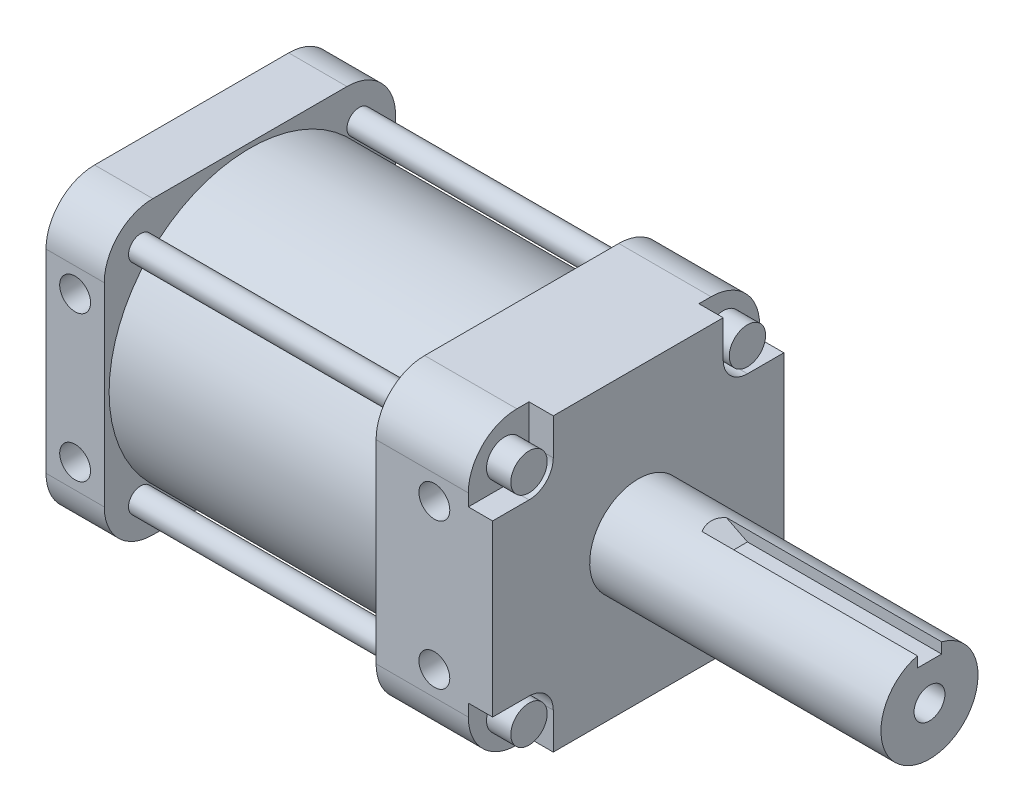
from build123d import *

# Parameters (mm, degrees)
BOSS_EXTRUDE1_DEPTH                  = 7.62
SKETCH2_R                            = 18.415
BOSS_EXTRUDE2_DEPTH                  = 35.56
BOSS_EXTRUDE3_DEPTH                  = 15.24
SKETCH5_R                            = 6.35
BOSS_EXTRUDE4_DEPTH                  = 38.1
F_10_32_TAPPED_HOLE1_D               = 4.0386
F_10_32_TAPPED_HOLE1_DEPTH           = 7.62
F_10_32_TAPPED_HOLE1_TIP             = 1.213317848
F_10_32_TAPPED_HOLE1_ON_FACE_2_D     = 4.0386
F_10_32_TAPPED_HOLE1_ON_FACE_2_DEPTH = 7.62
F_10_32_TAPPED_HOLE1_ON_FACE_2_TIP   = 1.213317848
CUT_EXTRUDE1_START                   = -7.62
SKETCH8_R                            = 17.78
CUT_EXTRUDE1_DEPTH                   = 45.72
CUT_EXTRUDE2_REACH                   = 102.209
SKETCH9_R                            = 6
CUT_EXTRUDE3_DEPTH                   = 1.5875
F_10_32_TAPPED_HOLE2_D               = 4.0386
F_10_32_TAPPED_HOLE2_DEPTH           = 7.62
F_10_32_TAPPED_HOLE2_TIP             = 1.213317848
CUT_EXTRUDE4_DEPTH                   = 3.175
BOSS_EXTRUDE5_REACH                  = 61.758
SKETCH15_R                           = 1.5875
SKETCH16_R                           = 2.38125
BOSS_EXTRUDE6_DEPTH                  = 3.175


with BuildPart() as part:
    # Sketch1 → Boss-Extrude1 (new body)
    with BuildSketch(Plane(origin=(0, 0, 0), x_dir=(0, 0, -1), z_dir=(1, 0, 0))):
        with BuildLine():
            Line((-12.7, 19.05), (12.7, 19.05))
            ThreePointArc((12.7, 19.05), (17.190128061, 17.190128061), (19.05, 12.7))
            Line((19.05, 12.7), (19.05, -12.7))
            ThreePointArc((19.05, -12.7), (17.190128061, -17.190128061), (12.7, -19.05))
            Line((12.7, -19.05), (-12.7, -19.05))
            ThreePointArc((-12.7, -19.05), (-17.190128061, -17.190128061), (-19.05, -12.7))
            Line((-19.05, -12.7), (-19.05, 12.7))
            ThreePointArc((-19.05, 12.7), (-17.190128061, 17.190128061), (-12.7, 19.05))
        make_face()
    extrude(amount=BOSS_EXTRUDE1_DEPTH)

    # Sketch2 → Boss-Extrude2 (add)
    with BuildSketch(Plane(origin=(7.62, 0, 0), x_dir=(0, 0, -1), z_dir=(1, 0, 0))):
        Circle(SKETCH2_R)
    extrude(amount=BOSS_EXTRUDE2_DEPTH)

    # Sketch4 → Boss-Extrude3 (add)
    with BuildSketch(Plane(origin=(43.18, 0, 0), x_dir=(0, 0, -1), z_dir=(1, 0, 0))):
        with BuildLine():
            Line((12.7, 19.05), (-12.7, 19.05))
            ThreePointArc((-12.7, 19.05), (-17.190128061, 17.190128061), (-19.05, 12.7))
            Line((-19.05, 12.7), (-19.05, -12.7))
            ThreePointArc((-19.05, -12.7), (-17.190128061, -17.190128061), (-12.7, -19.05))
            Line((-12.7, -19.05), (12.7, -19.05))
            ThreePointArc((12.7, -19.05), (17.190128061, -17.190128061), (19.05, -12.7))
            Line((19.05, -12.7), (19.05, 12.7))
            ThreePointArc((19.05, 12.7), (17.190128061, 17.190128061), (12.7, 19.05))
        make_face()
    extrude(amount=BOSS_EXTRUDE3_DEPTH)

    # Sketch5 → Boss-Extrude4 (add)
    with BuildSketch(Plane(origin=(58.42, 0, 0), x_dir=(0, 0, -1), z_dir=(1, 0, 0))):
        Circle(SKETCH5_R)
    extrude(amount=BOSS_EXTRUDE4_DEPTH)

    # #10-32 Tapped Hole1
    with Locations(Plane(origin=(50.8, 9.525, -19.05), x_dir=(-1, 0, 0), z_dir=(0, 0, -1))):
        with Locations((0, 0), (0, -19.05), (46.99, 0), (46.99, -19.05)):
            Hole(F_10_32_TAPPED_HOLE1_D / 2, depth=F_10_32_TAPPED_HOLE1_DEPTH)
            with Locations((0, 0, -(F_10_32_TAPPED_HOLE1_DEPTH + F_10_32_TAPPED_HOLE1_TIP / 2))):  # 118° drill point
                Cone(0, F_10_32_TAPPED_HOLE1_D / 2, F_10_32_TAPPED_HOLE1_TIP, mode=Mode.SUBTRACT)

    # #10-32 Tapped Hole1 on face 2
    with Locations(Plane(origin=(50.8, 9.525, 19.05), x_dir=(1, 0, 0), z_dir=(0, 0, 1))):
        with Locations((0, 0), (0, -19.05), (-46.99, 0), (-46.99, -19.05)):
            Hole(F_10_32_TAPPED_HOLE1_ON_FACE_2_D / 2, depth=F_10_32_TAPPED_HOLE1_ON_FACE_2_DEPTH)
            with Locations((0, 0, -(F_10_32_TAPPED_HOLE1_ON_FACE_2_DEPTH + F_10_32_TAPPED_HOLE1_ON_FACE_2_TIP / 2))):  # 118° drill point
                Cone(0, F_10_32_TAPPED_HOLE1_ON_FACE_2_D / 2, F_10_32_TAPPED_HOLE1_ON_FACE_2_TIP, mode=Mode.SUBTRACT)

    # Sketch8 → Cut-Extrude1 (cut)
    with BuildSketch(Plane.ZY.offset(CUT_EXTRUDE1_START)):
        Circle(SKETCH8_R)
    extrude(amount=-CUT_EXTRUDE1_DEPTH, mode=Mode.SUBTRACT)

    # Sketch9 → Cut-Extrude2 (cut, up to next)
    with BuildSketch(Plane.ZY, mode=Mode.PRIVATE) as cut_extrude2_sk1:
        Circle(SKETCH9_R)
    cut_extrude2_tool1 = extrude(cut_extrude2_sk1.sketch, amount=-CUT_EXTRUDE2_REACH, mode=Mode.PRIVATE) & part.part
    add(cut_extrude2_tool1.solids().sort_by_distance((0, 0, 0))[0], mode=Mode.SUBTRACT)

    # Sketch10 → Cut-Extrude3 (cut, symmetric)
    with BuildSketch(Plane.XY):
        Polygon((96.52, 4.7625), (71.12, 4.7625), (67.945, 6.35), (96.52, 6.35), align=None)
    extrude(amount=CUT_EXTRUDE3_DEPTH, both=True, mode=Mode.SUBTRACT)

    # #10-32 Tapped Hole2
    with Locations(Plane(origin=(96.52, 0, 0), x_dir=(0, 0, -1), z_dir=(1, 0, 0))):
        with Locations((0, 0)):
            Hole(F_10_32_TAPPED_HOLE2_D / 2, depth=F_10_32_TAPPED_HOLE2_DEPTH)
            with Locations((0, 0, -(F_10_32_TAPPED_HOLE2_DEPTH + F_10_32_TAPPED_HOLE2_TIP / 2))):  # 118° drill point
                Cone(0, F_10_32_TAPPED_HOLE2_D / 2, F_10_32_TAPPED_HOLE2_TIP, mode=Mode.SUBTRACT)

    # Sketch14 → Cut-Extrude4 (cut)
    with BuildSketch(Plane(origin=(58.42, 0, 0), x_dir=(0, 0, -1), z_dir=(1, 0, 0))):
        with BuildLine():
            Line((-14.2875, 11.1125), (-19.05, 11.1125))
            Line((-19.05, 11.1125), (-19.05, 19.05))
            Line((-19.05, 19.05), (-11.1125, 19.05))
            Line((-11.1125, 19.05), (-11.1125, 14.2875))
            ThreePointArc((-11.1125, 14.2875), (-12.04243597, 12.04243597), (-14.2875, 11.1125))
        make_face()
        with BuildLine():
            Line((-14.2875, -11.1125), (-19.05, -11.1125))
            Line((-19.05, -11.1125), (-19.05, -19.05))
            Line((-19.05, -19.05), (-11.1125, -19.05))
            Line((-11.1125, -19.05), (-11.1125, -14.2875))
            ThreePointArc((-11.1125, -14.2875), (-12.04243597, -12.04243597), (-14.2875, -11.1125))
        make_face()
        with BuildLine():
            Line((11.1125, 14.2875), (11.1125, 19.05))
            Line((11.1125, 19.05), (19.05, 19.05))
            Line((19.05, 19.05), (19.05, 11.1125))
            Line((19.05, 11.1125), (14.2875, 11.1125))
            ThreePointArc((14.2875, 11.1125), (12.04243597, 12.04243597), (11.1125, 14.2875))
        make_face()
        with BuildLine():
            Line((14.2875, -11.1125), (19.05, -11.1125))
            Line((19.05, -11.1125), (19.05, -19.05))
            Line((19.05, -19.05), (11.1125, -19.05))
            Line((11.1125, -19.05), (11.1125, -14.2875))
            ThreePointArc((11.1125, -14.2875), (12.04243597, -12.04243597), (14.2875, -11.1125))
        make_face()
    extrude(amount=-CUT_EXTRUDE4_DEPTH, mode=Mode.SUBTRACT)

    # Sketch15 → Boss-Extrude5 (add, up to next)
    with BuildSketch(Plane.ZY.offset(-43.18), mode=Mode.PRIVATE) as boss_extrude5_sk1:
        with Locations((14.2875, 14.2875)):
            Circle(SKETCH15_R)
    boss_extrude5_tool1 = extrude(boss_extrude5_sk1.sketch, amount=BOSS_EXTRUDE5_REACH, mode=Mode.PRIVATE) - part.part
    # Sketch15 → Boss-Extrude5 (add, up to next)
    with BuildSketch(Plane.ZY.offset(-43.18), mode=Mode.PRIVATE) as boss_extrude5_sk2:
        with Locations((-14.2875, 14.2875)):
            Circle(SKETCH15_R)
    boss_extrude5_tool2 = extrude(boss_extrude5_sk2.sketch, amount=BOSS_EXTRUDE5_REACH, mode=Mode.PRIVATE) - part.part
    # Sketch15 → Boss-Extrude5 (add, up to next)
    with BuildSketch(Plane.ZY.offset(-43.18), mode=Mode.PRIVATE) as boss_extrude5_sk3:
        with Locations((14.2875, -14.2875)):
            Circle(SKETCH15_R)
    boss_extrude5_tool3 = extrude(boss_extrude5_sk3.sketch, amount=BOSS_EXTRUDE5_REACH, mode=Mode.PRIVATE) - part.part
    # Sketch15 → Boss-Extrude5 (add, up to next)
    with BuildSketch(Plane.ZY.offset(-43.18), mode=Mode.PRIVATE) as boss_extrude5_sk4:
        with Locations((-14.2875, -14.2875)):
            Circle(SKETCH15_R)
    boss_extrude5_tool4 = extrude(boss_extrude5_sk4.sketch, amount=BOSS_EXTRUDE5_REACH, mode=Mode.PRIVATE) - part.part
    add(boss_extrude5_tool1.solids().sort_by_distance((43.18, 14.2875, 14.2875))[0])
    add(boss_extrude5_tool2.solids().sort_by_distance((43.18, 14.2875, -14.2875))[0])
    add(boss_extrude5_tool3.solids().sort_by_distance((43.18, -14.2875, 14.2875))[0])
    add(boss_extrude5_tool4.solids().sort_by_distance((43.18, -14.2875, -14.2875))[0])

    # Sketch16 → Boss-Extrude6 (add)
    with BuildSketch(Plane(origin=(55.245, 0, 0), x_dir=(0, 0, -1), z_dir=(1, 0, 0))):
        with Locations((-14.2875, 14.2875)):
            Circle(SKETCH16_R)
        with Locations((-14.2875, -14.2875)):
            Circle(SKETCH16_R)
        with Locations((14.2875, -14.2875)):
            Circle(SKETCH16_R)
        with Locations((14.2875, 14.2875)):
            Circle(SKETCH16_R)
    extrude(amount=BOSS_EXTRUDE6_DEPTH)


solid = part.part
